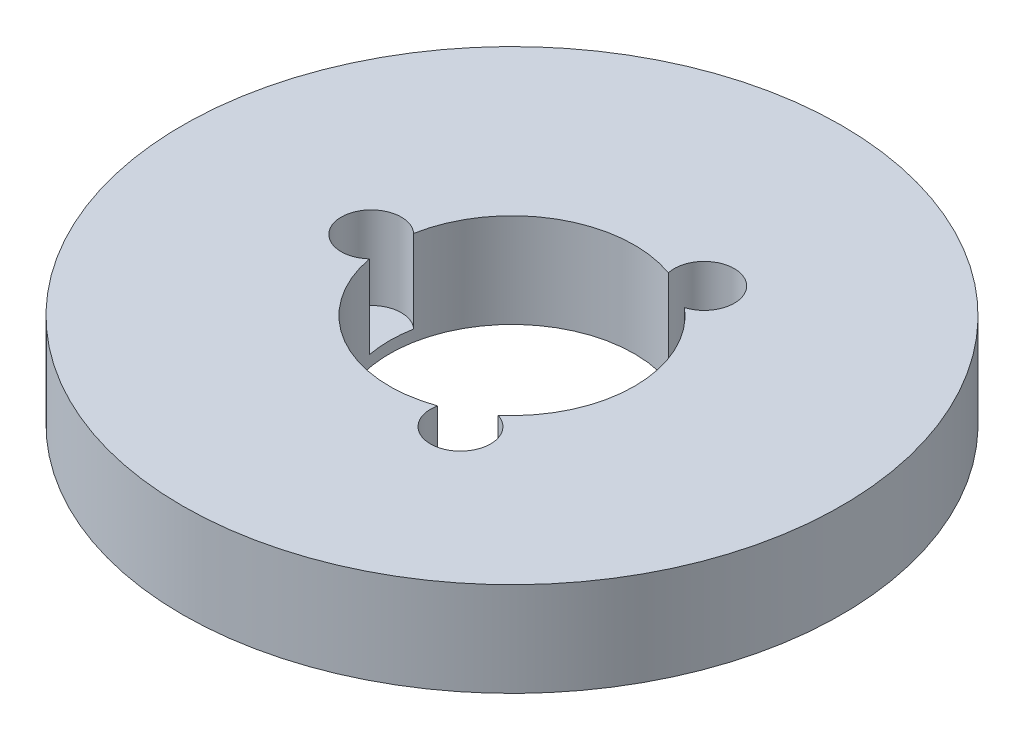
from build123d import *

# Parameters (mm, degrees)
SKETCH1_R           = 87.5
BOSS_EXTRUDE1_DEPTH = 25
SKETCH2_R           = 32.5
CUT_EXTRUDE1_DEPTH  = 127.24381173
SKETCH3_R           = 7.975756775
CUT_EXTRUDE2_DEPTH  = 21.986004329
CIRPATTERN1_COUNT   = 3


with BuildPart() as part:
    # Sketch1 → Boss-Extrude1 (new body)
    with BuildSketch(Plane(origin=(0, 0, 0), x_dir=(1, 0, 0), z_dir=(0, 1, 0))):
        Circle(SKETCH1_R)
    extrude(amount=BOSS_EXTRUDE1_DEPTH)

    # Sketch2 → Cut-Extrude1 (cut, through all)
    with BuildSketch(Plane(origin=(0, 0, 0), x_dir=(1, 0, 0), z_dir=(0, 1, 0))):
        Circle(SKETCH2_R)
    extrude(amount=CUT_EXTRUDE1_DEPTH, mode=Mode.SUBTRACT)

    # Sketch3 → Cut-Extrude2 (cut)
    with BuildSketch(Plane(origin=(0, 25, 0), x_dir=(1, 0, 0), z_dir=(0, 1, 0))):
        with Locations((-37.364630723, 0)):
            Circle(SKETCH3_R)
    cut_extrude2 = extrude(amount=-CUT_EXTRUDE2_DEPTH, mode=Mode.SUBTRACT)

    # CirPattern1: Cut-Extrude2 ×3 about axis
    cirpattern1_axis = Axis((0, 0, 0), (0, 1, 0))
    for i in range(1, CIRPATTERN1_COUNT):
        add(cut_extrude2.rotate(cirpattern1_axis, i * 360 / CIRPATTERN1_COUNT), mode=Mode.SUBTRACT)


solid = part.part
